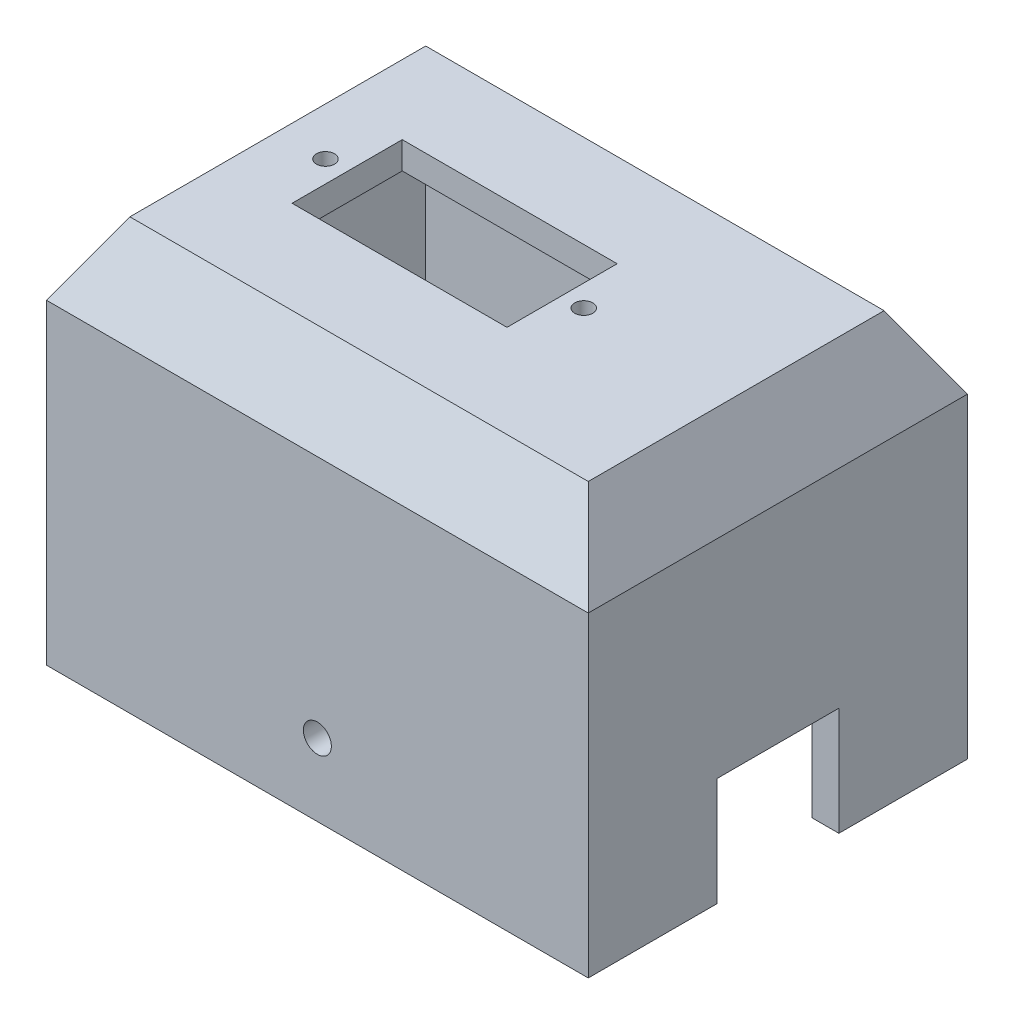
from build123d import *
from OCP.BRepFilletAPI import BRepFilletAPI_MakeChamfer

# Parameters (mm, degrees)
SKETCH_47_W         = 60
SKETCH_47_H         = 42
EXTRUDE_4_DEPTH     = 43
CHAMFER_1_SIZE      = 8
CHAMFER_1_SIZE2     = 4.618802154
SHELL_1_T           = -3
CUT_EXTRUDE_3_REACH = 84.735
SKETCH_48_R         = 1
SKETCH_48_W         = 23.8
SKETCH_48_H         = 12.2
SKETCH_49_R         = 1.55
CUT_EXTRUDE_4_DEPTH = 68.178865724
CUT_EXTRUDE_5_REACH = 78.746
SKETCH_50_W         = 13.5
SKETCH_50_H         = 12
CUT_EXTRUDE_6_REACH = 78.746
SKETCH_51_W         = 8.981203982
SKETCH_51_H         = 13.761919886


with BuildPart() as part:
    # 草图47 → 凸台-拉伸4 (new body)
    with BuildSketch(Plane(origin=(0, 0, 0), x_dir=(1, 0, 0), z_dir=(0, 1, 0))):
        Rectangle(SKETCH_47_W, SKETCH_47_H)
    extrude(amount=EXTRUDE_4_DEPTH)

    # 倒角1: one chamfer whose edges measure the first distance from different faces: ONE call of the kernel's chamfer builder (chamfer() names one face for all edges)
    chamfer_1_edges_1 = [part.edges().sort_by_distance(p)[0] for p in [
        (0, 43, -21),
    ]]
    chamfer_1_side_1 = [part.faces().sort_by_distance(p)[0] for p in [
        (0, 21.5, -21),
    ]]
    chamfer_1_edges_2 = [part.edges().sort_by_distance(p)[0] for p in [
        (30, 43, 0),
    ]]
    chamfer_1_side_2 = [part.faces().sort_by_distance(p)[0] for p in [
        (30, 21.5, 0),
    ]]
    chamfer_1_edges_3 = [part.edges().sort_by_distance(p)[0] for p in [
        (0, 43, 21),
    ]]
    chamfer_1_side_3 = [part.faces().sort_by_distance(p)[0] for p in [
        (0, 21.5, 21),
    ]]
    chamfer_1_edges_4 = [part.edges().sort_by_distance(p)[0] for p in [
        (-30, 43, 0),
    ]]
    chamfer_1_side_4 = [part.faces().sort_by_distance(p)[0] for p in [
        (-30, 21.5, 0),
    ]]
    chamfer_1 = BRepFilletAPI_MakeChamfer(part.part.solid().wrapped)
    for e in chamfer_1_edges_1:
        chamfer_1.Add(CHAMFER_1_SIZE, CHAMFER_1_SIZE2, e.wrapped, chamfer_1_side_1[0].wrapped)  # the first distance lies on this face
    for e in chamfer_1_edges_2:
        chamfer_1.Add(CHAMFER_1_SIZE, CHAMFER_1_SIZE2, e.wrapped, chamfer_1_side_2[0].wrapped)  # the first distance lies on this face
    for e in chamfer_1_edges_3:
        chamfer_1.Add(CHAMFER_1_SIZE, CHAMFER_1_SIZE2, e.wrapped, chamfer_1_side_3[0].wrapped)  # the first distance lies on this face
    for e in chamfer_1_edges_4:
        chamfer_1.Add(CHAMFER_1_SIZE, CHAMFER_1_SIZE2, e.wrapped, chamfer_1_side_4[0].wrapped)  # the first distance lies on this face
    add(Compound.cast(chamfer_1.Shape()), mode=Mode.REPLACE)

    # 抽壳1
    shell_1_openings = [part.faces().sort_by_distance(p)[0] for p in [
        (0, 0, 0),
    ]]
    offset(amount=SHELL_1_T, openings=shell_1_openings, kind=Kind.INTERSECTION)

    # 草图48 → 切除-拉伸3 (cut, up to next)
    with BuildSketch(Plane(origin=(0, 43, -43), x_dir=(1, 0, 0), z_dir=(0, -1, 0)), mode=Mode.PRIVATE) as cut_extrude_3_sk1:
        with Locations((-20.1, 43)):
            Circle(SKETCH_48_R)
    cut_extrude_3_tool1 = extrude(cut_extrude_3_sk1.sketch, amount=CUT_EXTRUDE_3_REACH, mode=Mode.PRIVATE) & part.part
    # 草图48 → 切除-拉伸3 (cut, up to next)
    with BuildSketch(Plane(origin=(0, 43, -43), x_dir=(1, 0, 0), z_dir=(0, -1, 0)), mode=Mode.PRIVATE) as cut_extrude_3_sk2:
        with Locations((8.5, 43)):
            Circle(SKETCH_48_R)
    cut_extrude_3_tool2 = extrude(cut_extrude_3_sk2.sketch, amount=CUT_EXTRUDE_3_REACH, mode=Mode.PRIVATE) & part.part
    # 草图48 → 切除-拉伸3 (cut, up to next)
    with BuildSketch(Plane(origin=(0, 43, -43), x_dir=(1, 0, 0), z_dir=(0, -1, 0)), mode=Mode.PRIVATE) as cut_extrude_3_sk3:
        with Locations((-5.8, 43)):
            Rectangle(SKETCH_48_W, SKETCH_48_H)
    cut_extrude_3_tool3 = extrude(cut_extrude_3_sk3.sketch, amount=CUT_EXTRUDE_3_REACH, mode=Mode.PRIVATE) & part.part
    add(cut_extrude_3_tool1.solids().sort_by_distance((-20.1, 43, 0))[0], mode=Mode.SUBTRACT)
    add(cut_extrude_3_tool2.solids().sort_by_distance((8.5, 43, 0))[0], mode=Mode.SUBTRACT)
    add(cut_extrude_3_tool3.solids().sort_by_distance((-5.8, 43, 0))[0], mode=Mode.SUBTRACT)

    # 草图49 → 切除-拉伸4 (cut, through all)
    with BuildSketch(Plane(origin=(0, 0, -21), x_dir=(-1, 0, 0), z_dir=(0, 0, -1))):
        with Locations((0, 8)):
            Circle(SKETCH_49_R)
    extrude(amount=-CUT_EXTRUDE_4_DEPTH, mode=Mode.SUBTRACT)

    # 草图50 → 切除-拉伸5 (cut, up to next)
    with BuildSketch(Plane(origin=(30, 0, 0), x_dir=(0, 0, -1), z_dir=(1, 0, 0)), mode=Mode.PRIVATE) as cut_extrude_5_sk1:
        with Locations((0, 6)):
            Rectangle(SKETCH_50_W, SKETCH_50_H)
    cut_extrude_5_tool1 = extrude(cut_extrude_5_sk1.sketch, amount=-CUT_EXTRUDE_5_REACH, mode=Mode.PRIVATE) & part.part
    add(cut_extrude_5_tool1.solids().sort_by_distance((30, 6, 0))[0], mode=Mode.SUBTRACT)

    # 草图51 → 切除-拉伸6 (cut, up to next)
    with BuildSketch(Plane.ZY.offset(30), mode=Mode.PRIVATE) as cut_extrude_6_sk1:
        with Locations((0, 6.880959943)):
            Rectangle(SKETCH_51_W, SKETCH_51_H)
    cut_extrude_6_tool1 = extrude(cut_extrude_6_sk1.sketch, amount=-CUT_EXTRUDE_6_REACH, mode=Mode.PRIVATE) & part.part
    add(cut_extrude_6_tool1.solids().sort_by_distance((-30, 6.88096, 0))[0], mode=Mode.SUBTRACT)


solid = part.part
